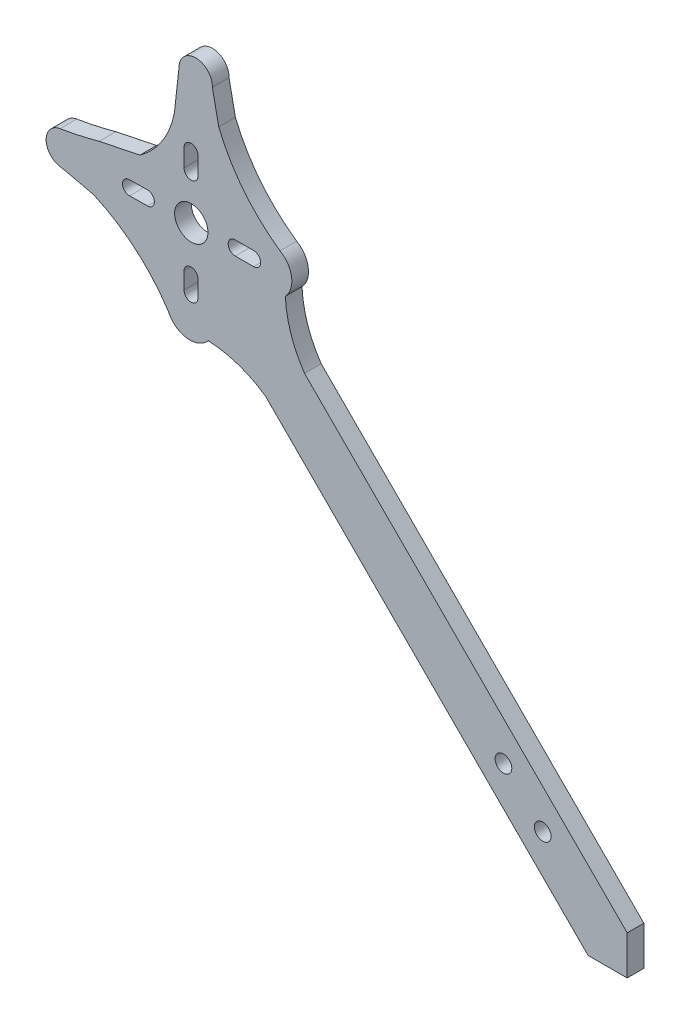
from build123d import *

# Parameters (mm, degrees)
SKETCH1_R           = 1.5
SKETCH1_R_2         = 3
BOSS_EXTRUDE1_DEPTH = 3


with BuildPart() as part:
    # Sketch1 → Boss-Extrude1 (new body)
    with BuildSketch(Plane.XY):
        with BuildLine():
            Line((-31.12514237, -29.726748611), (-28.242608501, -30.411902417))
            ThreePointArc((-28.242608501, -30.411902417), (-20.68959708, -35.158083098), (-14.80107725, -41.858795508))
            ThreePointArc((-14.80107725, -41.858795508), (-11.493211721, -44.355762457), (-7.63505705, -42.842005266))
            ThreePointArc((-7.63505705, -42.842005266), (-2.246442761, -43.861832253), (2.658803994, -46.314537964))
            Line((2.658803994, -46.314537964), (60.733034664, -104.475893585))
            Line((60.733034664, -104.475893585), (67.779305025, -104.475893585))
            Line((67.779305025, -104.475893585), (67.779305025, -97.4401784))
            Line((67.779305025, -97.4401784), (9.706693424, -39.277206187))
            ThreePointArc((9.706693424, -39.277206187), (7.261343971, -34.368288068), (6.249596253, -28.978151002))
            ThreePointArc((6.249596253, -28.978151002), (7.37829321, -25.443697958), (5.295874165, -22.372892517))
            ThreePointArc((5.295874165, -22.372892517), (-1.219884154, -16.280347391), (-5.730664145, -8.58443442))
            Line((-5.730664145, -8.58443442), (-6.879743118, -2.987437054))
            ThreePointArc((-6.879743118, -2.987437054), (-9.785712486, 0.103734574), (-12.876884114, -2.802234794))
            Line((-12.876884114, -2.802234794), (-13.698267335, -10.257121084))
            ThreePointArc((-13.698267335, -10.257121084), (-15.841461471, -15.765254165), (-19.906987044, -20.055278984))
            Line((-19.906987044, -20.055278984), (-27.249090358, -21.586134602))
            ThreePointArc((-27.249090358, -21.586134602), (-30.750859785, -22.449348896), (-34.292441763, -23.131056406))
            ThreePointArc((-34.292441763, -23.131056406), (-36.801292663, -26.057968815), (-34.356720395, -29.038776678))
            ThreePointArc((-34.356720395, -29.038776678), (-32.736871785, -29.363693691), (-31.12514237, -29.726748611))
        make_face()
        with Locations((52.574817163, -89.257539534)):
            Circle(SKETCH1_R, mode=Mode.SUBTRACT)
        with Locations((-10.675182837, -26.007539534)):
            Circle(SKETCH1_R_2, mode=Mode.SUBTRACT)
        with Locations((45.509051492, -82.181173554)):
            Circle(SKETCH1_R, mode=Mode.SUBTRACT)
        with BuildLine():
            Line((-11.977500222, -18.10767184), (-11.977500222, -14.881035995))
            ThreePointArc((-11.977500222, -14.881035995), (-10.720903951, -13.624439724), (-9.46430768, -14.881035995))
            Line((-9.46430768, -14.881035995), (-9.46430768, -18.10767184))
            ThreePointArc((-9.46430768, -18.10767184), (-10.720903951, -19.364268111), (-11.977500222, -18.10767184))
        make_face(mode=Mode.SUBTRACT)
        with BuildLine():
            Line((-11.977500222, -34.151314032), (-11.977500222, -37.134043073))
            ThreePointArc((-11.977500222, -37.134043073), (-10.720903951, -38.390639344), (-9.46430768, -37.134043073))
            Line((-9.46430768, -37.134043073), (-9.46430768, -34.151314032))
            ThreePointArc((-9.46430768, -34.151314032), (-10.720903951, -32.894717761), (-11.977500222, -34.151314032))
        make_face(mode=Mode.SUBTRACT)
        with BuildLine():
            Line((-2.775315143, -24.705222149), (0.550814101, -24.705222149))
            ThreePointArc((0.550814101, -24.705222149), (1.807410372, -25.96181842), (0.550814101, -27.218414691))
            Line((0.550814101, -27.218414691), (-2.775315143, -27.218414691))
            ThreePointArc((-2.775315143, -27.218414691), (-4.031911414, -25.96181842), (-2.775315143, -24.705222149))
        make_face(mode=Mode.SUBTRACT)
        with BuildLine():
            Line((-18.589595345, -24.796748556), (-21.816015039, -24.83409613))
            ThreePointArc((-21.816015039, -24.83409613), (-23.057982315, -26.105153036), (-21.786925409, -27.347120313))
            Line((-21.786925409, -27.347120313), (-18.560505715, -27.30977274))
            ThreePointArc((-18.560505715, -27.30977274), (-17.318538439, -26.038715833), (-18.589595345, -24.796748556))
        make_face(mode=Mode.SUBTRACT)
    extrude(amount=BOSS_EXTRUDE1_DEPTH)


solid = part.part
